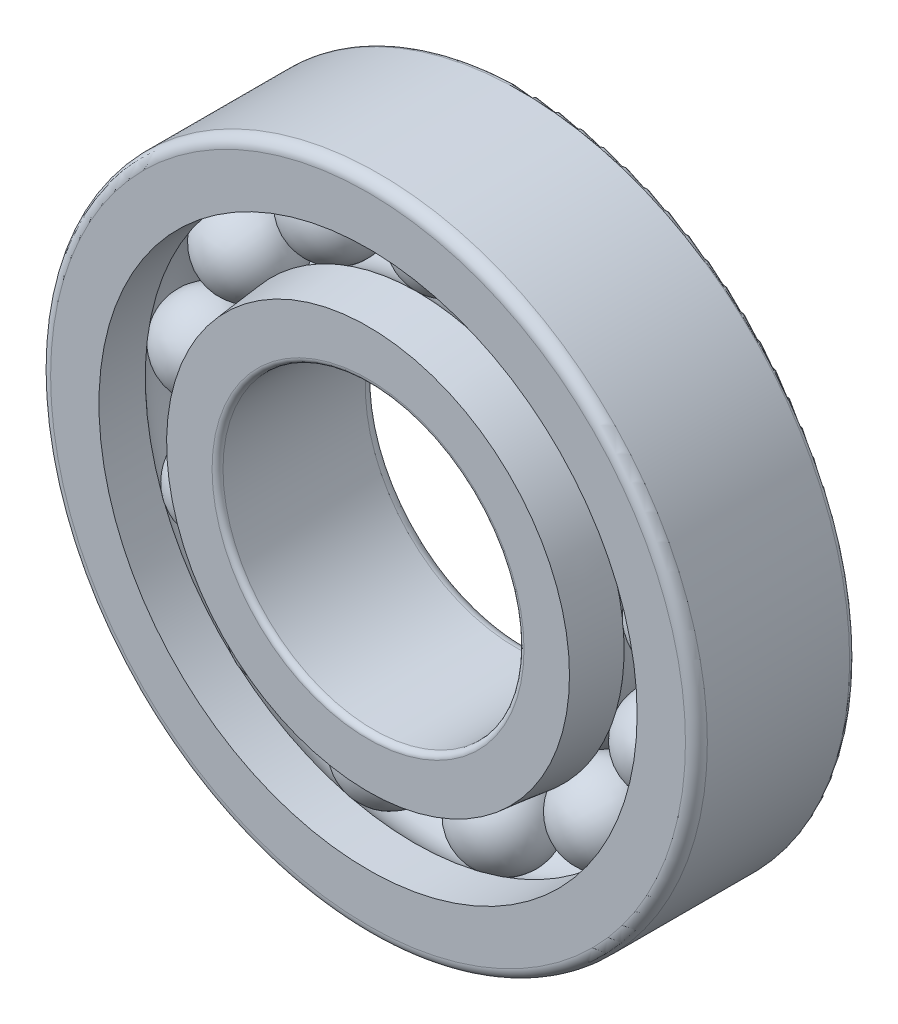
from build123d import *

# Parameters (mm, degrees)
FILLET1_R            = 2
FILLET2_R            = 1
CIRPATTERNBALL_COUNT = 13


with BuildPart() as part:
    # BaseSke → Ball (revolve)
    with BuildSketch(Plane(origin=(0, 0, 0), x_dir=(0, 0, -1), z_dir=(1, 0, 0))):
        with BuildLine():
            Line((0, 51.875), (0, 35.625))
            ThreePointArc((0, 35.625), (-8.125, 43.75), (0, 51.875))
        make_face()
    ball = revolve(axis=Axis((0, 51.875, 0), (0, -1, 0)))

    # OuterRaceSke → OuterRace (revolve)
    with BuildSketch(Plane(origin=(0, 0, 0), x_dir=(0, 0, -1), z_dir=(1, 0, 0))):
        with BuildLine():
            Line((-14.5, 60), (14.5, 60))
            Line((14.5, 60), (14.5, 50.690678078))
            Line((14.5, 50.690678078), (5.472721814, 49.741872908))
            ThreePointArc((5.472721814, 49.741872908), (-0.404850898, 51.854894864), (-6.042594412, 49.166666667))
            Line((-6.042594412, 49.166666667), (-14.5, 49.166666667))
            Line((-14.5, 49.166666667), (-14.5, 60))
        make_face()
    revolve(axis=Axis((0, 0, 50.391616343), (0, 0, -1)))

    # InnerRaceSke → InnerRace (revolve)
    with BuildSketch(Plane(origin=(0, 0, 0), x_dir=(0, 0, -1), z_dir=(1, 0, 0))):
        with BuildLine():
            Line((-14.5, 27.5), (14.5, 27.5))
            Line((14.5, 27.5), (14.5, 38.333333333))
            Line((14.5, 38.333333333), (6.042594412, 38.333333333))
            ThreePointArc((6.042594412, 38.333333333), (0, 35.635), (-6.042594412, 38.333333333))
            Line((-6.042594412, 38.333333333), (-14.5, 38.333333333))
            Line((-14.5, 38.333333333), (-14.5, 27.5))
        make_face()
    revolve(axis=Axis((0, 0, 70.862590906), (0, 0, -1)))

    # Fillet1
    fillet1_edges = [part.edges().sort_by_distance(p)[0] for p in [
        (0, -27.5, -14.5),
        (0, -60, 14.5),
    ]]
    fillet(fillet1_edges, radius=FILLET1_R)

    # Fillet2
    fillet2_edges = [part.edges().sort_by_distance(p)[0] for p in [
        (0, -60, -14.5),
        (0, -27.5, 14.5),
    ]]
    fillet(fillet2_edges, radius=FILLET2_R)

    # CutInnerRaceSke → CutInnerRace (revolve, cut)
    with BuildSketch(Plane(origin=(0, 0, 0), x_dir=(0, 0, -1), z_dir=(1, 0, 0))):
        with BuildLine():
            Line((-6.042594412, 38.333333333), (-14.5, 38.333333333))
            Line((-14.5, 38.333333333), (-14.5, 36.809321922))
            Line((-14.5, 36.809321922), (-5.472721814, 37.758127092))
            ThreePointArc((-5.472721814, 37.758127092), (-5.764836728, 38.038618162), (-6.042594412, 38.333333333))
        make_face()
    revolve(axis=Axis((0, 0, 28.306583022), (0, 0, -1)), mode=Mode.SUBTRACT)

    # CirPatternBall: Ball ×13 about axis
    cirpatternball_axis = Axis((0, 0, 50.391616343), (0, 0, -1))
    for i in range(1, CIRPATTERNBALL_COUNT):
        add(ball.rotate(cirpatternball_axis, i * 360 / CIRPATTERNBALL_COUNT))


solid = part.part
